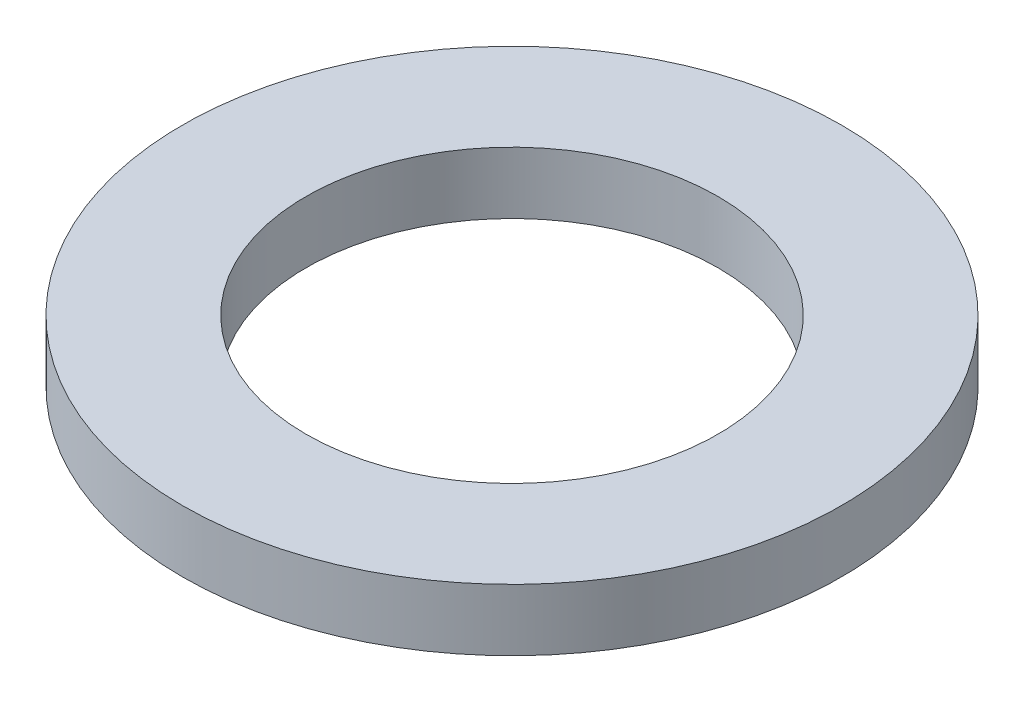
from build123d import *

# Parameters (mm, degrees)
SKETCH1_R           = 80
BOSS_EXTRUDE1_DEPTH = 15
SKETCH2_R           = 50
CUT_EXTRUDE1_DEPTH  = 115.127122105


with BuildPart() as part:
    # Sketch1 → Boss-Extrude1 (new body)
    with BuildSketch(Plane(origin=(0, 0, 0), x_dir=(1, 0, 0), z_dir=(0, 1, 0))):
        Circle(SKETCH1_R)
    extrude(amount=BOSS_EXTRUDE1_DEPTH)

    # Sketch2 → Cut-Extrude1 (cut, through all)
    with BuildSketch(Plane(origin=(0, 0, 0), x_dir=(1, 0, 0), z_dir=(0, 1, 0))):
        Circle(SKETCH2_R)
    extrude(amount=CUT_EXTRUDE1_DEPTH, mode=Mode.SUBTRACT)


solid = part.part
